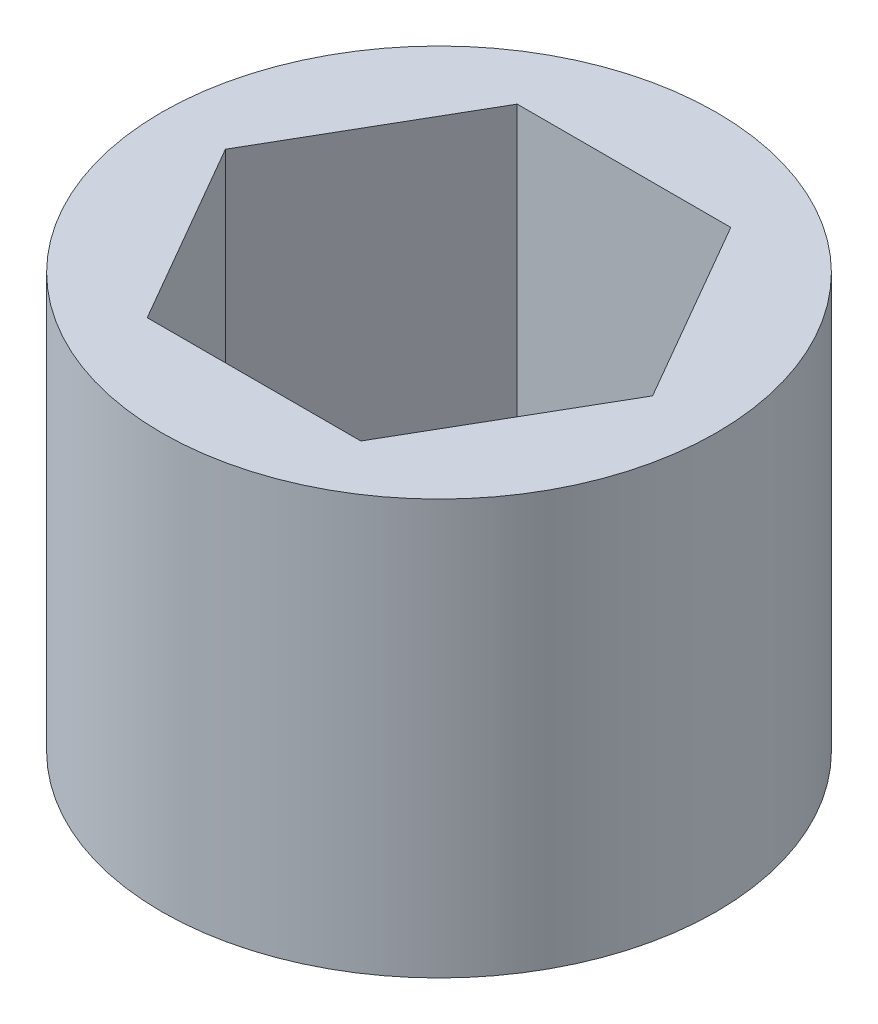
from build123d import *

# Parameters (mm, degrees)
SKETCH1_R           = 9.525
BOSS_EXTRUDE1_DEPTH = 14.2367


with BuildPart() as part:
    # Sketch1 → Boss-Extrude1 (new body)
    with BuildSketch(Plane(origin=(0, 0, 0), x_dir=(1, 0, 0), z_dir=(0, 1, 0))):
        Circle(SKETCH1_R)
        Polygon((7.332348419, 0), (3.666174209, 6.35), (-3.666174209, 6.35), (-7.332348419, 0), (-3.666174209, -6.35), (3.666174209, -6.35), align=None, mode=Mode.SUBTRACT)
    extrude(amount=BOSS_EXTRUDE1_DEPTH)


solid = part.part
